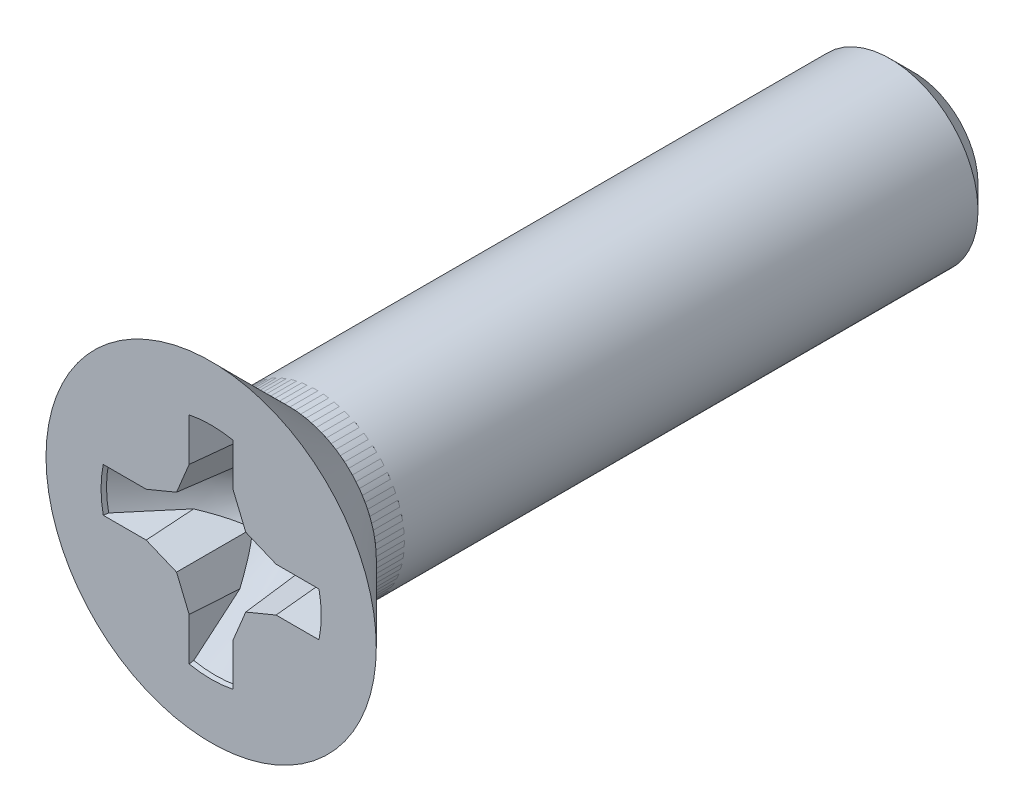
from build123d import *

# Parameters (mm, degrees)
SKETCH1_R          = 2.35
EXTRUDE3_DEPTH     = 1.5
SKETCH4_W          = 8.9
SKETCH4_H          = 1.25
CHAMFER1_SIZE      = 0.3375
CUT_EXTRUDE3_REACH = 12.538
CIRPATTERN1_COUNT  = 4
DRAFT2_ANGLE       = 5


# Read off the part's stored shape, not the designer's step: Extrude10, Draft1
with BuildPart() as part:
    # Sketch1 → Extrude3 (new body)
    with BuildSketch(Plane.XY):
        Circle(SKETCH1_R)
    extrude(amount=EXTRUDE3_DEPTH)

    # Sketch11 → Cut-Revolve3 (revolve, cut)
    with BuildSketch(Plane(origin=(0, 0, 0), x_dir=(0, 0, -1), z_dir=(1, 0, 0)), mode=Mode.PRIVATE) as cut_revolve3_sk:
        Polygon((0, 0.85), (-1.5, 2.35), (0, 2.35), align=None)
    revolve(cut_revolve3_sk.sketch.rotate(Axis((0, 0, -0.441444004), (0, 0, 1)), 90), axis=Axis((0, 0, -0.441444004), (0, 0, 1)), mode=Mode.SUBTRACT)

    # Extrude10 outline → Extrude10 (revolve)
    with BuildSketch(Plane.XZ):
        Polygon((1.25, 0), (1.25, 0.4), (0.85, 0.4), (0.85, 0), (0, 0), (0, -1.25), align=None)
    revolve(axis=Axis((0, 0, 0), (0, 0, 1)))

    # Cut-Extrude3: up to this cone (the profile starts inside it)
    cut_extrude3_end = Plane(origin=(0, 0, 1.5), z_dir=(0, 0, 1)).offset(-1.611465251) * Cone(1e-06, 16.260932502, 16.260931502, align=(Align.CENTER, Align.CENTER, Align.MIN), mode=Mode.PRIVATE)
    # Sketch12 → Cut-Extrude3 (cut, up to the surface)
    with BuildSketch(Plane.XY.offset(1.5), mode=Mode.PRIVATE) as cut_extrude3_sk1:
        with BuildLine():
            Line((1.535013572, 0.313333333), (0.924173453, 0.313333333))
            Line((0.924173453, 0.313333333), (0.492244262, 0.492244262))
            Line((0.492244262, 0.492244262), (0.313333333, 0.924173453))
            Line((0.313333333, 0.924173453), (0.313333333, 1.535013572))
            ThreePointArc((0.313333333, 1.535013572), (0.15746404, 1.558733306), (0, 1.566666667))
            Line((0, 1.566666667), (0, 0))
            Line((0, 0), (1.566666667, 0))
            ThreePointArc((1.566666667, 0), (1.558733306, 0.15746404), (1.535013572, 0.313333333))
        make_face()
    cut_extrude3_tool1 = extrude(cut_extrude3_sk1.sketch, amount=-CUT_EXTRUDE3_REACH, mode=Mode.PRIVATE) & cut_extrude3_end
    cut_extrude3 = cut_extrude3_tool1.solids().sort_by_distance((1.229594, 0.291177, 1.5))[0]
    add(cut_extrude3, mode=Mode.SUBTRACT)

    # CirPattern1: Cut-Extrude3 ×4 about axis
    cirpattern1_axis = Axis((0, 0, 0), (0, 0, 1))
    for i in range(1, CIRPATTERN1_COUNT):
        add(cut_extrude3.rotate(cirpattern1_axis, i * 360 / CIRPATTERN1_COUNT), mode=Mode.SUBTRACT)

    # Draft1 outline → Draft1 (revolve)
    with BuildSketch(Plane.XZ):
        Polygon((1.566666667, 1.5), (1.550268881, 1.43880263), (1.566666667, 1.43880263), align=None)
    revolve(axis=Axis((0, 0, 0), (0, 0, 1)))

    # Draft2
    draft2_faces = [part.faces().sort_by_distance(p)[0] for p in [
        (0.313333333, 1.140840621, 1.286158691),
        (0.408124508, 0.695327313, 1.100915441),
        (0.695327313, 0.408124508, 1.100915441),
        (1.140840621, 0.313333333, 1.286158691),
        (1.140840621, -0.313333333, 1.286158691),
        (0.695327313, -0.408124508, 1.100915441),
        (0.408124508, -0.695327313, 1.100915441),
        (0.313333333, -1.140840621, 1.286158691),
        (-0.313333333, -1.140840621, 1.286158691),
        (-0.408124508, -0.695327313, 1.100915441),
        (-0.695327313, -0.408124508, 1.100915441),
        (-1.140840621, -0.313333333, 1.286158691),
        (-1.140840621, 0.313333333, 1.286158691),
        (-0.695327313, 0.408124508, 1.100915441),
        (-0.408124508, 0.695327313, 1.100915441),
        (-0.313333333, 1.140840621, 1.286158691),
    ]]
    draft(draft2_faces, Plane.XY.offset(1.5), DRAFT2_ANGLE)


with BuildPart() as body_2:
    # Sketch4 → Revolve1 (revolve)
    with BuildSketch(Plane(origin=(0, 0, 0), x_dir=(0, 0, -1), z_dir=(1, 0, 0)), mode=Mode.PRIVATE) as revolve1_sk:
        with Locations((4.05, 0.625)):
            Rectangle(SKETCH4_W, SKETCH4_H)
    revolve(revolve1_sk.sketch.rotate(Axis((0, 0, 0.4), (0, 0, -1)), 180), axis=Axis((0, 0, 0.4), (0, 0, -1)))

    # Chamfer1
    chamfer1_edges = [body_2.edges().sort_by_distance(p)[0] for p in [
        (0, 1.25, -8.5),
    ]]
    chamfer(chamfer1_edges, length=CHAMFER1_SIZE)


solid = Compound([part.part, body_2.part])
